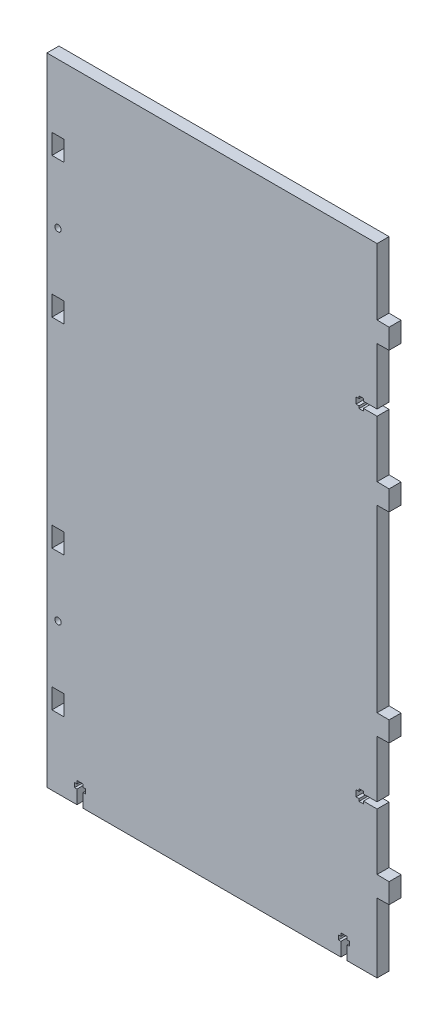
from build123d import *

# Parameters (mm, degrees)
SKETCH_1_R      = 1.6
SKETCH_1_W      = 6.1
SKETCH_1_H      = 10
EXTRUDE_1_DEPTH = 6


with BuildPart() as part:
    # Эскиз1 → Бобышка-Вытянуть1 (new body)
    with BuildSketch(Plane.XY):
        Polygon((1078.719864828, 623.038519), (1084.719864828, 623.138519), (1084.719864828, 633.138519), (1078.719864828, 633.238519), (1078.719864828, 723.038519), (1084.719864828, 723.138519), (1084.719864828, 733.138519), (1078.719864828, 733.238519), (1078.719864828, 761.588519), (1071.919864828, 761.588519), (1071.919864828, 760.388519), (1069.719864828, 760.388519), (1069.719864828, 761.588519), (1068.219864828, 761.588519), (1068.219864828, 764.688519), (1069.719864828, 764.688519), (1069.719864828, 765.888519), (1071.919864828, 765.888519), (1071.919864828, 764.688519), (1078.719864828, 764.688519), (1078.719864828, 793.038519), (1084.719864828, 793.138519), (1084.719864828, 803.138519), (1078.719864828, 803.238519), (1078.719864828, 836.338519), (978.719864828, 836.338519), (913.719864828, 836.338519), (913.719864828, 518.436195), (928.719864828, 518.436195), (928.719864828, 525.236195), (927.519864828, 525.236195), (927.519864828, 527.436195), (928.719864828, 527.436195), (928.719864828, 528.936195), (931.819864828, 528.936195), (931.819864828, 527.436195), (933.019864828, 527.436195), (933.019864828, 525.236195), (931.819864828, 525.236195), (931.819864828, 518.436195), (978.719864828, 518.436195), (1060.619864828, 518.436195), (1060.619864828, 525.236195), (1059.419864828, 525.236195), (1059.419864828, 527.436195), (1060.619864828, 527.436195), (1060.619864828, 528.936195), (1063.719864828, 528.936195), (1063.719864828, 527.436195), (1064.919864828, 527.436195), (1064.919864828, 525.236195), (1063.719864828, 525.236195), (1063.719864828, 518.436195), (1078.719864828, 518.436195), (1078.719864828, 553.038519), (1084.719864828, 553.138519), (1084.719864828, 563.138519), (1078.719864828, 563.238519), (1078.719864828, 591.588519), (1071.919864828, 591.588519), (1071.919864828, 590.388519), (1069.719864828, 590.388519), (1069.719864828, 591.588519), (1068.219864828, 591.588519), (1068.219864828, 594.688519), (1069.719864828, 594.688519), (1069.719864828, 595.888519), (1071.919864828, 595.888519), (1071.919864828, 594.688519), (1078.719864828, 594.688519), align=None)
        with Locations((919.269864828, 593.238519)):
            Circle(SKETCH_1_R, mode=Mode.SUBTRACT)
        with Locations((919.269864828, 763.238519)):
            Circle(SKETCH_1_R, mode=Mode.SUBTRACT)
        with Locations((919.269864828, 558.238519)):
            Rectangle(SKETCH_1_W, SKETCH_1_H, mode=Mode.SUBTRACT)
        with Locations((919.269864828, 628.238519)):
            Rectangle(SKETCH_1_W, SKETCH_1_H, mode=Mode.SUBTRACT)
        with Locations((919.269864828, 728.238519)):
            Rectangle(SKETCH_1_W, SKETCH_1_H, mode=Mode.SUBTRACT)
        with Locations((919.269864828, 798.238519)):
            Rectangle(SKETCH_1_W, SKETCH_1_H, mode=Mode.SUBTRACT)
    extrude(amount=EXTRUDE_1_DEPTH)


solid = part.part
